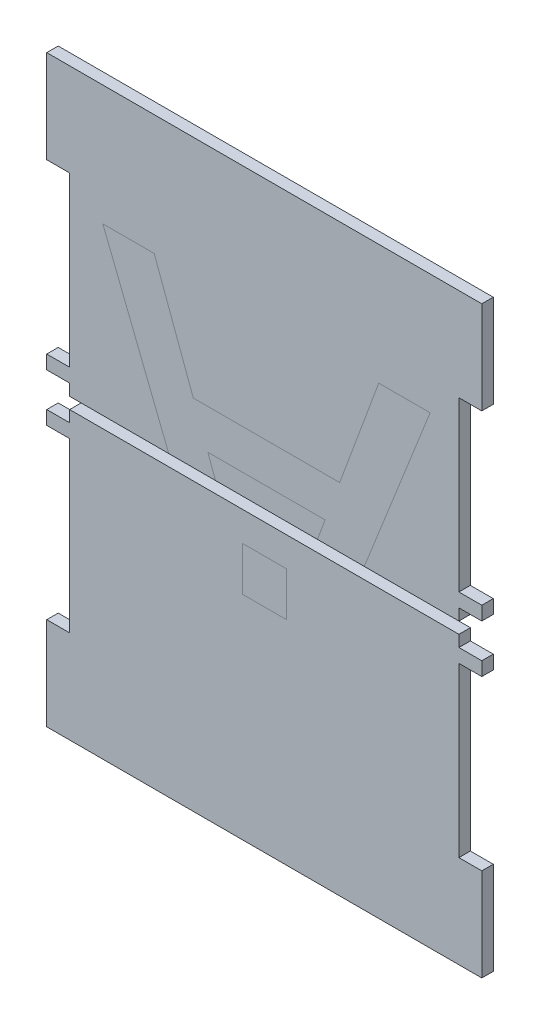
from build123d import *

# Parameters (mm, degrees)
FLIPS_DEPTH             = 1
FLIPS_2_DEPTH           = 1
NEXT_CUT_START          = 0.5
NEXT_CUT_DEPTH          = 0.5
NEXT_EXTRUDE_START      = 0.5
NEXT_EXTRUDE_DEPTH      = 0.5
PREV_CHAR_W             = 3.846153846
PREV_CHAR_H             = 3.846153846
PREV_CUT_DEPTH          = 0.5
PREV_CHAR_2_W           = 3.846153846
PREV_CHAR_2_H           = 3.846153846
PREV_EXTRUDE_DEPTH      = 0.5
PREV_EXTRUDE_2_DEPTH    = 0.5
CLEANUP_CUT2_DEPTH      = 32.815876543
CLEANUP_CUT2_DEPTH_BACK = 32.815876543
FRONT_CHAR_5_OUTSIDE_W  = 52.722
FRONT_CHAR_5_OUTSIDE_H  = 65.722


# Read off the part's stored shape, not the designer's step: Next_Cut, Next_Extrude
with BuildPart() as part:
    # Front_Char → Flips (new body)
    with BuildSketch(Plane.XY):
        Polygon((19, 1.5), (19, 2.7), (17, 2.7), (17, 17.394721707), (19, 17.394721707), (19, 25.5), (-19, 25.5), (-19, 17.394721707), (-17, 17.394721707), (-17, 2.7), (-19, 2.7), (-19, 1.5), (-17, 1.5), (-17, 0.5), (17, 0.5), (17, 1.5), align=None)
    extrude(amount=FLIPS_DEPTH)

    # Next_Cut outline → Next_Cut (cut)
    with BuildSketch(Plane.XY.offset(NEXT_CUT_START)):
        Polygon((8.732171474, 0.5), (14.489182692, 15), (10, 15), (6.586538462, 5.769230769), (-6.201923077, 5.769230769), (-9.615384615, 15), (-14.104567308, 15), (-8.34755609, 0.5), (-4.2596447, 0.5), (-4.927884615, 2.307692308), (5.3125, 2.307692308), (4.644098575, 0.5), align=None)
    extrude(amount=NEXT_CUT_DEPTH, mode=Mode.SUBTRACT)


with BuildPart() as body_2:
    # Front_Char → Flips 2 (new body)
    with BuildSketch(Plane.XY):
        Polygon((17, -0.5), (17, -1.5), (19, -1.5), (19, -2.7), (17, -2.7), (17, -17.394721707), (19, -17.394721707), (19, -25.5), (-19, -25.5), (-19, -17.394721707), (-17, -17.394721707), (-17, -2.7), (-19, -2.7), (-19, -1.5), (-17, -1.5), (-17, -0.5), align=None)
    extrude(amount=FLIPS_2_DEPTH)

    # Prev_Char → Prev_Cut (cut)
    with BuildSketch(Plane.XY.offset(1)):
        with Locations((0, -5)):
            Rectangle(PREV_CHAR_W, PREV_CHAR_H)
        with BuildLine():
            Line((1.923076923, 15), (1.923076923, 11.153846154))
            Line((1.923076923, 11.153846154), (-1.923076923, 11.153846154))
            Line((-1.923076923, 11.153846154), (-1.923076923, 15))
            add(Edge.make_bspline(
                [(-1.923076923, 15), (-1.914283477, 15.381050549), (-1.897511731, 16.107828482), (-1.760729141, 17.13971916), (-1.535383466, 18.056755761), (-1.21810162, 18.870165784), (-0.781937434, 19.577961225), (-0.245734256, 20.202360907), (0.404415871, 20.737461165), (0.900608511, 21.013146805), (1.153846154, 21.153846154)],
                knots=[0, 0, 0, 0, 1.252840278, 2.389542986, 3.415356866, 4.352460491, 5.24846073, 6.135967884, 7.048669687, 8, 8, 8, 8], degree=3))
            Line((1.153846154, 21.153846154), (1.923076923, 19.591346154))
            add(Edge.make_bspline(
                [(1.923076923, 19.591346154), (1.770942867, 19.496344705), (1.468198769, 19.307293492), (1.083033595, 18.931305848), (0.751943485, 18.50073585), (0.489822241, 17.994020356), (0.290655303, 17.397983725), (0.147350709, 16.699875597), (0.04372328, 15.888255652), (0.023043187, 15.308859313), (0.012019231, 15)],
                knots=[0, 0, 0, 0, 0.822197349, 1.636158272, 2.457375741, 3.30978844, 4.244349105, 5.336795784, 6.580323398, 8, 8, 8, 8], degree=3))
            Line((0.012019231, 15), (1.923076923, 15))
        make_face()
    extrude(amount=-PREV_CUT_DEPTH, mode=Mode.SUBTRACT)


with BuildPart() as body_3:
    # Next_Extrude outline → Next_Extrude (new body)
    with BuildSketch(Plane.XY.offset(NEXT_EXTRUDE_START)):
        Polygon((14.489182692, 15), (10, 15), (6.586538462, 5.769230769), (-6.201923077, 5.769230769), (-9.615384615, 15), (-14.104567308, 15), (-2.193509615, -15), (2.578125, -15), align=None)
        with BuildLine():
            add(Edge.make_bspline(
                [(0.192307692, -11.538461538), (0.307335645, -11.063663008), (0.538313239, -10.110261514), (1.015808404, -8.714356834), (1.570995037, -7.334346462), (2.016925505, -6.445433183), (2.241586538, -5.997596154)],
                knots=[0, 0, 0, 0, 0.247288569, 0.496558596, 0.746364794, 1, 1, 1, 1], degree=3))
            add(Edge.make_bspline(
                [(-2.013221154, -5.576923077), (-1.901483363, -5.88157387), (-1.683014884, -6.477223694), (-1.357212563, -7.342652605), (-1.059564813, -8.164499419), (-0.767696751, -8.930980031), (-0.504222239, -9.653228343), (-0.261371027, -10.326365893), (-0.021193229, -10.945714053), (0.122940847, -11.345876781), (0.192307692, -11.538461538)],
                knots=[0, 0, 0, 0, 0.153148109, 0.299433469, 0.436426351, 0.565670573, 0.68650831, 0.799268516, 0.903394741, 1, 1, 1, 1], degree=3))
            Line((-2.013221154, -5.576923077), (-4.927884615, 2.307692308))
            Line((-4.927884615, 2.307692308), (5.3125, 2.307692308))
            Line((5.3125, 2.307692308), (2.241586538, -5.997596154))
        make_face(mode=Mode.SUBTRACT)
    extrude(amount=NEXT_EXTRUDE_DEPTH)

    # Front_Char<5> outside → CleanUp_Cut2 (cut, two sides: drawn at the far end of the back side and taken through both)
    with BuildSketch(Plane.XY.offset(-CLEANUP_CUT2_DEPTH_BACK)):
        Rectangle(FRONT_CHAR_5_OUTSIDE_W, FRONT_CHAR_5_OUTSIDE_H)
        Polygon((19, 1.5), (19, 2.7), (17, 2.7), (17, 17.394721707), (19, 17.394721707), (19, 25.5), (-19, 25.5), (-19, 17.394721707), (-17, 17.394721707), (-17, 2.7), (-19, 2.7), (-19, 1.5), (-17, 1.5), (-17, 0.5), (17, 0.5), (17, 1.5), align=None, mode=Mode.SUBTRACT)
        Polygon((17, -0.5), (17, -1.5), (19, -1.5), (19, -2.7), (17, -2.7), (17, -17.394721707), (19, -17.394721707), (19, -25.5), (-19, -25.5), (-19, -17.394721707), (-17, -17.394721707), (-17, -2.7), (-19, -2.7), (-19, -1.5), (-17, -1.5), (-17, -0.5), align=None, mode=Mode.SUBTRACT)
    extrude(amount=CLEANUP_CUT2_DEPTH + CLEANUP_CUT2_DEPTH_BACK, mode=Mode.SUBTRACT)


with BuildPart() as body_4:
    # Prev_Char<2> → Prev_Extrude (new body)
    with BuildSketch(Plane.XY.offset(1)):
        with Locations((0, -5)):
            Rectangle(PREV_CHAR_2_W, PREV_CHAR_2_H)
    extrude(amount=-PREV_EXTRUDE_DEPTH)


with BuildPart() as body_5:
    # Prev_Char<2> → Prev_Extrude 2 (new body)
    with BuildSketch(Plane.XY.offset(1)):
        with BuildLine():
            Line((1.923076923, 15), (1.923076923, 11.153846154))
            Line((1.923076923, 11.153846154), (-1.923076923, 11.153846154))
            Line((-1.923076923, 11.153846154), (-1.923076923, 15))
            add(Edge.make_bspline(
                [(-1.923076923, 15), (-1.914283477, 15.381050549), (-1.897511731, 16.107828482), (-1.760729141, 17.13971916), (-1.535383466, 18.056755761), (-1.21810162, 18.870165784), (-0.781937434, 19.577961225), (-0.245734256, 20.202360907), (0.404415871, 20.737461165), (0.900608511, 21.013146805), (1.153846154, 21.153846154)],
                knots=[0, 0, 0, 0, 1.252840278, 2.389542986, 3.415356866, 4.352460491, 5.24846073, 6.135967884, 7.048669687, 8, 8, 8, 8], degree=3))
            Line((1.153846154, 21.153846154), (1.923076923, 19.591346154))
            add(Edge.make_bspline(
                [(1.923076923, 19.591346154), (1.770942867, 19.496344705), (1.468198769, 19.307293492), (1.083033595, 18.931305848), (0.751943485, 18.50073585), (0.489822241, 17.994020356), (0.290655303, 17.397983725), (0.147350709, 16.699875597), (0.04372328, 15.888255652), (0.023043187, 15.308859313), (0.012019231, 15)],
                knots=[0, 0, 0, 0, 0.822197349, 1.636158272, 2.457375741, 3.30978844, 4.244349105, 5.336795784, 6.580323398, 8, 8, 8, 8], degree=3))
            Line((0.012019231, 15), (1.923076923, 15))
        make_face()
    extrude(amount=-PREV_EXTRUDE_2_DEPTH)


with BuildPart() as cleanup_cut2_piece_1:
    # of the separate pieces the step leaves, piece 1, a body of its own (cleanup_cut2_pieces)
    add(body_3.part.solids().sort_by_distance((14.489182692, 15, 0.5))[0])


with BuildPart() as cleanup_cut2_piece_2:
    # of the separate pieces the step leaves, piece 2, a body of its own (cleanup_cut2_pieces)
    add(body_3.part.solids().sort_by_distance((2.578125, -15, 0.5))[0])


solid = Compound([part.part, body_2.part, body_4.part, cleanup_cut2_piece_1.part])
